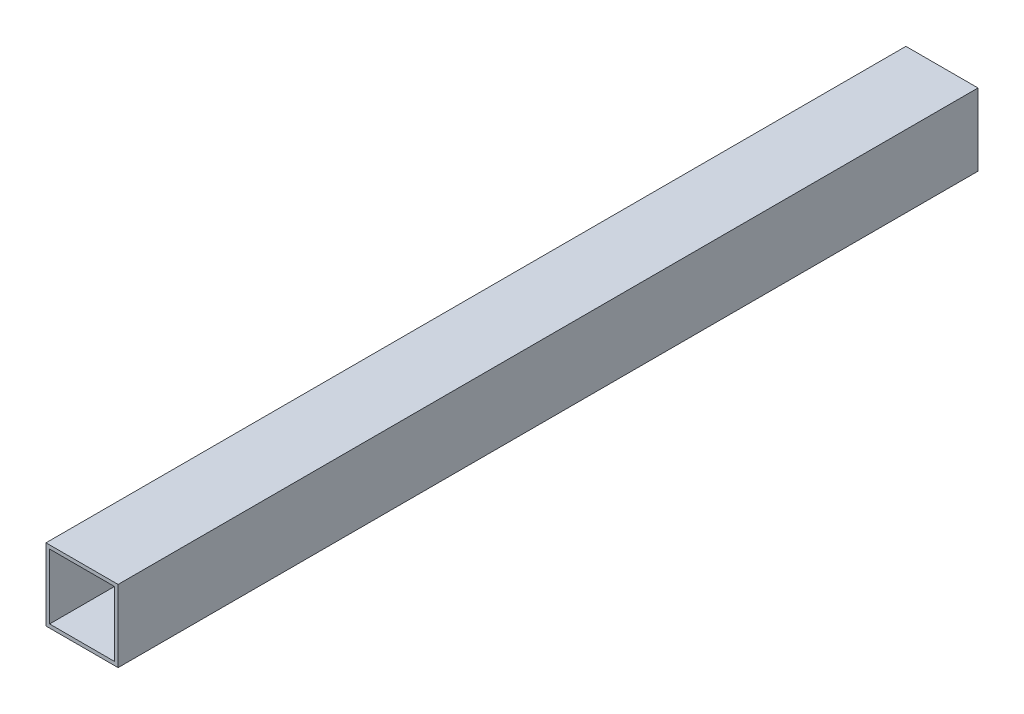
from build123d import *

# Parameters (mm, degrees)
SKETCH_1_W      = 20
SKETCH_1_H      = 20
SKETCH_1_W_2    = 18
SKETCH_1_H_2    = 18
EXTRUDE_1_DEPTH = 238.56


with BuildPart() as part:
    # 草图1 → 凸台-拉伸1 (new body)
    with BuildSketch(Plane.XY):
        Rectangle(SKETCH_1_W, SKETCH_1_H)
        Rectangle(SKETCH_1_W_2, SKETCH_1_H_2, mode=Mode.SUBTRACT)
    extrude(amount=EXTRUDE_1_DEPTH)


solid = part.part
